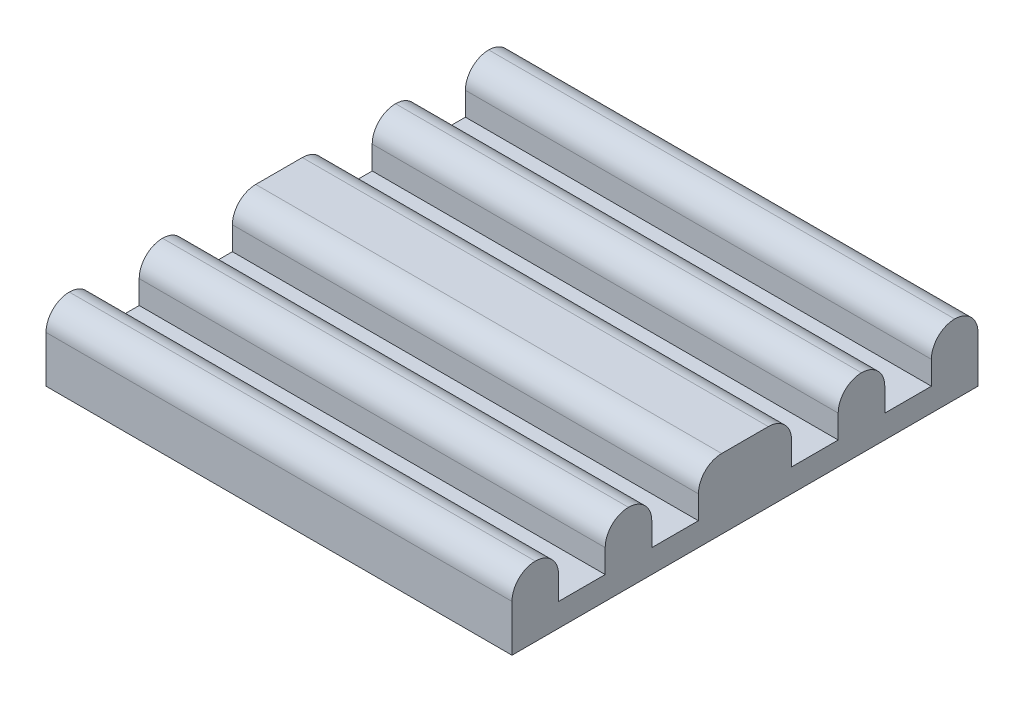
from build123d import *

# Parameters (mm, degrees)
SKETCH_1_W          = 20
SKETCH_1_H          = 20
EXTRUDE_1_DEPTH     = 3
SKETCH_2_W          = 20
SKETCH_2_H          = 2
CUT_EXTRUDE_1_DEPTH = 2
FILLET_1_R          = 1


with BuildPart() as part:
    # 草图1 → 凸台-拉伸1 (new body)
    with BuildSketch(Plane(origin=(0, 0, 0), x_dir=(1, 0, 0), z_dir=(0, 1, 0))):
        Rectangle(SKETCH_1_W, SKETCH_1_H)
    extrude(amount=EXTRUDE_1_DEPTH)

    # 草图2 → 切除-拉伸1 (cut)
    with BuildSketch(Plane(origin=(0, 3, 0), x_dir=(1, 0, 0), z_dir=(0, 1, 0))):
        with Locations((0, -7)):
            Rectangle(SKETCH_2_W, SKETCH_2_H)
        with Locations((0, -3)):
            Rectangle(SKETCH_2_W, SKETCH_2_H)
        with Locations((0, 7)):
            Rectangle(SKETCH_2_W, SKETCH_2_H)
        with Locations((0, 3)):
            Rectangle(SKETCH_2_W, SKETCH_2_H)
    extrude(amount=-CUT_EXTRUDE_1_DEPTH, mode=Mode.SUBTRACT)

    # 圆角1
    fillet_1_edges = [part.edges().sort_by_distance(p)[0] for p in [
        (0, 3, 10),
        (0, 3, 6),
        (0, 3, 8),
        (0, 3, -4),
        (0, 3, -2),
        (0, 3, -8),
        (0, 3, -6),
        (0, 3, 2),
        (0, 3, 4),
        (0, 3, -10),
    ]]
    fillet(fillet_1_edges, radius=FILLET_1_R - 0.0001)  # a hair under: the kernel refuses the full size


solid = part.part
